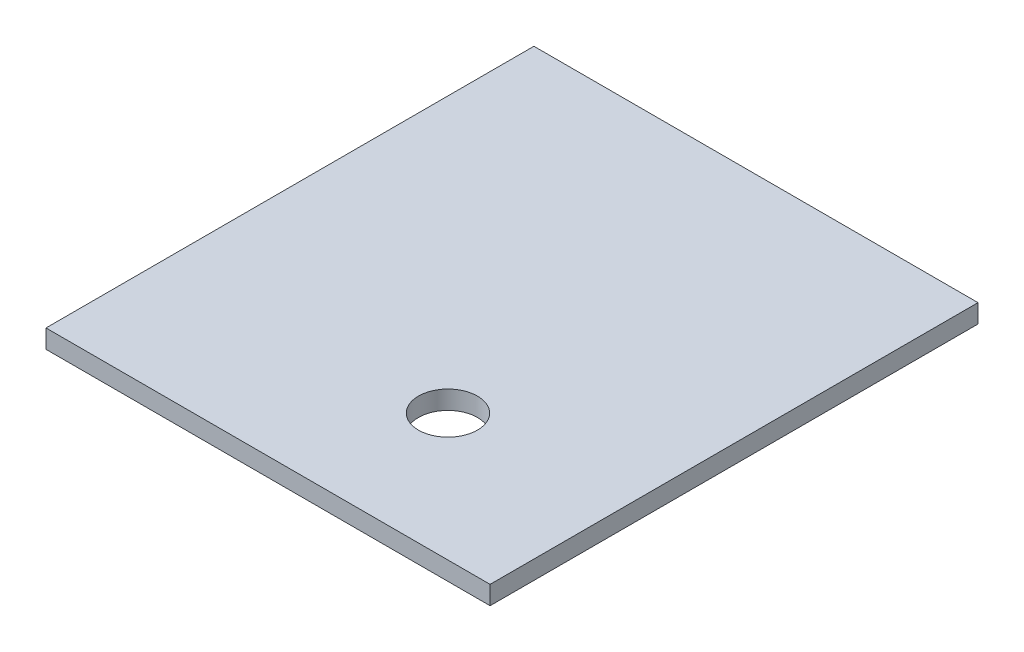
from build123d import *

# Parameters (mm, degrees)
SKETCH1_W           = 133.858
SKETCH1_H           = 147.066
BOSS_EXTRUDE1_DEPTH = 5.588
CUT_EXTRUDE1_REACH  = 101.588
SKETCH4_R           = 8.89


with BuildPart() as part:
    # Sketch1 → Boss-Extrude1 (new body)
    with BuildSketch(Plane(origin=(0, 0, 0), x_dir=(1, 0, 0), z_dir=(0, 1, 0))):
        Rectangle(SKETCH1_W, SKETCH1_H)
    extrude(amount=BOSS_EXTRUDE1_DEPTH)

    # Sketch4 → Cut-Extrude1 (cut, up to next)
    with BuildSketch(Plane(origin=(0, 5.588, 0), x_dir=(1, 0, 0), z_dir=(0, 1, 0)), mode=Mode.PRIVATE) as cut_extrude1_sk1:
        with Locations((15.875, -35.179)):
            Circle(SKETCH4_R)
    cut_extrude1_tool1 = extrude(cut_extrude1_sk1.sketch, amount=-CUT_EXTRUDE1_REACH, mode=Mode.PRIVATE) & part.part
    add(cut_extrude1_tool1.solids().sort_by_distance((15.875, 5.588, 35.179))[0], mode=Mode.SUBTRACT)


solid = part.part
